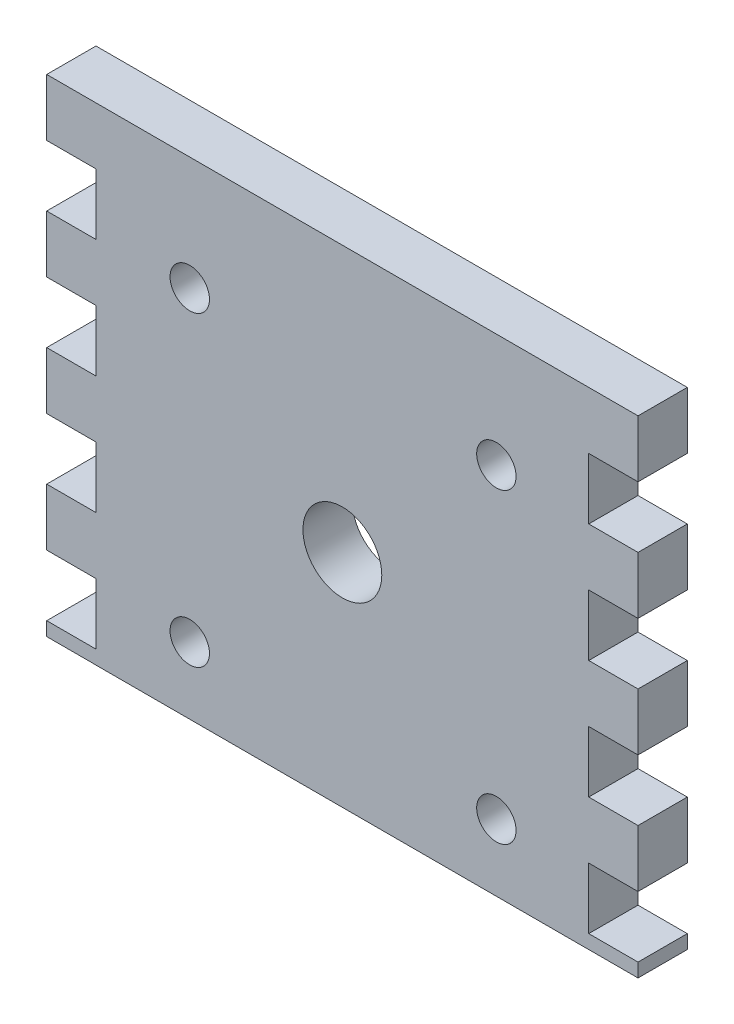
from build123d import *

# Parameters (mm, degrees)
SKETCH1_W           = 76.2
SKETCH1_H           = 76.2
BOSS_EXTRUDE1_DEPTH = 6.35
CUT_EXTRUDE1_DEPTH  = 6.35
SKETCH3_W           = 6.35
SKETCH3_H           = 38.1
CUT_EXTRUDE2_DEPTH  = 6.35
SKETCH4_W           = 6.35
SKETCH4_H           = 7.62
BOSS_EXTRUDE3_DEPTH = 6.35
SKETCH5_W           = 63.5
SKETCH5_H           = 6.35
CUT_EXTRUDE3_DEPTH  = 7.62
SKETCH6_R           = 5.08
SKETCH6_R_2         = 2.54
CUT_EXTRUDE4_DEPTH  = 71.769022866
SKETCH7_W           = 6.35
SKETCH7_H           = 7.62
BOSS_EXTRUDE4_DEPTH = 6.35
SKETCH9_W           = 63.5
SKETCH9_H           = 5.835909299
CUT_EXTRUDE5_DEPTH  = 6.35
SKETCH10_W          = 6.35
SKETCH10_H          = 6.35
BOSS_EXTRUDE5_DEPTH = 55.118
SKETCH11_W          = 6.35
SKETCH11_H          = 6.35
BOSS_EXTRUDE6_DEPTH = 55.118
CUT_EXTRUDE7_DEPTH  = 55.118


with BuildPart() as part:
    # Sketch1 → Boss-Extrude1 (new body)
    with BuildSketch(Plane.XY):
        with Locations((0.21991342, -21.056709957)):
            Rectangle(SKETCH1_W, SKETCH1_H)
    extrude(amount=BOSS_EXTRUDE1_DEPTH)

    # Sketch2 → Cut-Extrude1 (cut)
    with BuildSketch(Plane.XY.offset(6.35)):
        Polygon((-37.88008658, 17.043290043), (-31.53008658, 17.043290043), (-31.53008658, 9.423290043), (-37.88008658, 9.423290043), (-37.88008658, 1.803290043), (-31.53008658, 1.803290043), (-31.53008658, -5.816709957), (-37.88008658, -5.816709957), (-37.88008658, -13.436709957), (-31.53008658, -13.436709957), (-31.53008658, -21.056709957), (-37.88008658, -21.056709957), (-46.725849744, -21.056709957), (-46.725849744, 17.043290043), align=None)
        Polygon((47.165676584, -21.056709957), (47.165676584, 17.043290043), (38.31991342, 17.043290043), (31.96991342, 17.043290043), (31.96991342, 9.423290043), (38.31991342, 9.423290043), (38.31991342, 1.803290043), (31.96991342, 1.803290043), (31.96991342, -5.816709957), (38.31991342, -5.816709957), (38.31991342, -13.436709957), (31.96991342, -13.436709957), (31.96991342, -21.056709957), (38.31991342, -21.056709957), align=None)
    extrude(amount=-CUT_EXTRUDE1_DEPTH, mode=Mode.SUBTRACT)

    # Sketch3 → Cut-Extrude2 (cut)
    with BuildSketch(Plane.XY.offset(6.35)):
        with Locations((-34.70508658, -40.106709957)):
            Rectangle(SKETCH3_W, SKETCH3_H)
        with Locations((35.14491342, -40.106709957)):
            Rectangle(SKETCH3_W, SKETCH3_H)
    extrude(amount=-CUT_EXTRUDE2_DEPTH, mode=Mode.SUBTRACT)

    # Sketch4 → Boss-Extrude3 (add)
    with BuildSketch(Plane.XY.offset(6.35)):
        with Locations((-34.70508658, -24.866709957)):
            Rectangle(SKETCH4_W, SKETCH4_H)
        with Locations((35.14491342, -24.866709957)):
            Rectangle(SKETCH4_W, SKETCH4_H)
    extrude(amount=-BOSS_EXTRUDE3_DEPTH)

    # Sketch5 → Cut-Extrude3 (cut)
    with BuildSketch(Plane(origin=(0, 17.043290043, 0), x_dir=(1, 0, 0), z_dir=(0, 1, 0))):
        with Locations((0.21991342, -3.175)):
            Rectangle(SKETCH5_W, SKETCH5_H)
    extrude(amount=-CUT_EXTRUDE3_DEPTH, mode=Mode.SUBTRACT)

    # Sketch6 → Cut-Extrude4 (cut, through all)
    with BuildSketch(Plane.XY.offset(6.35)):
        with Locations((0.21991342, -24.866709957)):
            Circle(SKETCH6_R)
        with Locations((-19.446847485, -5.199949052)):
            Circle(SKETCH6_R_2)
        with Locations((20.066279447, -5.199949052)):
            Circle(SKETCH6_R_2)
        with Locations((20.066279447, -44.713075984)):
            Circle(SKETCH6_R_2)
        with Locations((-19.446847485, -44.713075984)):
            Circle(SKETCH6_R_2)
    extrude(amount=-CUT_EXTRUDE4_DEPTH, mode=Mode.SUBTRACT)

    # Sketch7 → Boss-Extrude4 (add)
    with BuildSketch(Plane.XY.offset(6.35)):
        with Locations((-34.70508658, -40.106709957)):
            Rectangle(SKETCH7_W, SKETCH7_H)
        with Locations((35.14491342, -40.106709957)):
            Rectangle(SKETCH7_W, SKETCH7_H)
    extrude(amount=-BOSS_EXTRUDE4_DEPTH)

    # Sketch9 → Cut-Extrude5 (cut)
    with BuildSketch(Plane.XY.offset(6.35)):
        with Locations((0.21991342, -56.238755307)):
            Rectangle(SKETCH9_W, SKETCH9_H)
    extrude(amount=-CUT_EXTRUDE5_DEPTH, mode=Mode.SUBTRACT)

    # Sketch10 → Boss-Extrude5 (add)
    with BuildSketch(Plane.XZ.offset(-1.803290043)):
        with Locations((35.14491342, 3.175)):
            Rectangle(SKETCH10_W, SKETCH10_H)
    extrude(amount=BOSS_EXTRUDE5_DEPTH)

    # Sketch11 → Boss-Extrude6 (add)
    with BuildSketch(Plane.XZ.offset(-1.803290043)):
        with Locations((-34.70508658, 3.175)):
            Rectangle(SKETCH11_W, SKETCH11_H)
    extrude(amount=BOSS_EXTRUDE6_DEPTH)

    # Sketch12 → Cut-Extrude7 (cut)
    with BuildSketch(Plane.XY.offset(6.35)):
        Polygon((-37.88008658, 2.057290043), (-37.88008658, 9.423290043), (-56.012271814, 9.423290043), (-56.012271814, -53.817588834), (-37.88008658, -51.536709957), (-31.53008658, -51.536709957), (-31.53008658, -43.662709957), (-37.88008658, -43.662709957), (-37.88008658, -36.296709957), (-31.53008658, -36.296709957), (-31.53008658, -28.422709957), (-37.88008658, -28.422709957), (-37.88008658, -21.056709957), (-31.53008658, -21.056709957), (-31.53008658, -13.182709957), (-37.88008658, -13.182709957), (-37.88008658, -5.816709957), (-31.53008658, -5.816709957), (-31.53008658, 2.057290043), align=None)
        Polygon((56.452098653, -53.817588834), (56.452098653, 9.423290043), (38.31991342, 9.423290043), (38.31991342, 2.057290043), (31.96991342, 2.057290043), (31.96991342, -5.816709957), (38.31991342, -5.816709957), (38.31991342, -13.182709957), (31.96991342, -13.182709957), (31.96991342, -21.056709957), (38.31991342, -21.056709957), (38.31991342, -28.422709957), (31.96991342, -28.422709957), (31.96991342, -36.296709957), (38.31991342, -36.296709957), (38.31991342, -43.662709957), (31.96991342, -43.662709957), (31.96991342, -51.536709957), (38.31991342, -51.536709957), align=None)
    extrude(amount=-CUT_EXTRUDE7_DEPTH, mode=Mode.SUBTRACT)


solid = part.part
